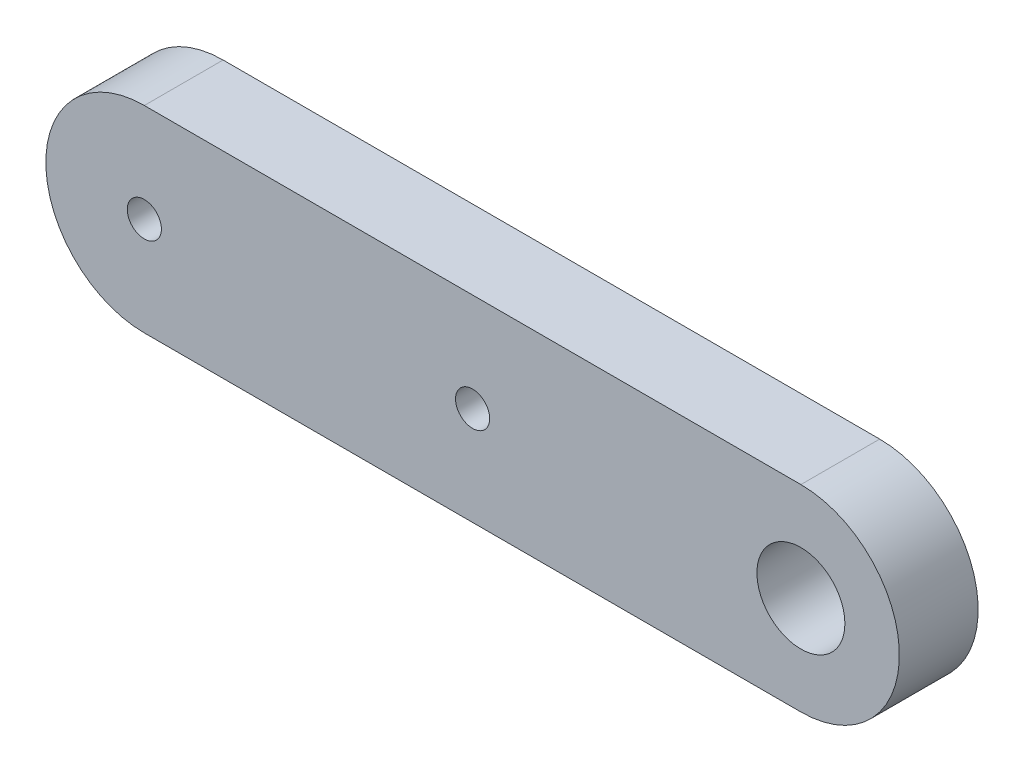
from build123d import *

# Parameters (mm, degrees)
BOSS_EXTRUDE1_DEPTH = 6
SKETCH2_R           = 1.3
CUT_EXTRUDE1_DEPTH  = 59.296655136
LPATTERN1_COUNT     = 4
LPATTERN1_PITCH     = 25
SKETCH3_R           = 3.35
CUT_EXTRUDE2_DEPTH  = 59.296655136


with BuildPart() as part:
    # Sketch1 → Boss-Extrude1 (new body)
    with BuildSketch(Plane.XY):
        with BuildLine():
            Line((50, 7.5), (0, 7.5))
            ThreePointArc((0, 7.5), (-7.5, 0), (0, -7.5))
            Line((0, -7.5), (50, -7.5))
            ThreePointArc((50, -7.5), (57.5, 0), (50, 7.5))
        make_face()
    extrude(amount=BOSS_EXTRUDE1_DEPTH)

    # Sketch2 → Cut-Extrude1 (cut, through all)
    with BuildSketch(Plane.XY.offset(6)):
        Circle(SKETCH2_R)
        with Locations((50, 0)):
            Circle(SKETCH2_R)
    cut_extrude1 = extrude(amount=-CUT_EXTRUDE1_DEPTH, mode=Mode.SUBTRACT)

    # LPattern1: Cut-Extrude1 ×4
    with Locations(*[(i * LPATTERN1_PITCH, 0, 0) for i in range(1, LPATTERN1_COUNT)]):
        add(cut_extrude1, mode=Mode.SUBTRACT)

    # Sketch3 → Cut-Extrude2 (cut, through all)
    with BuildSketch(Plane.XY.offset(6)):
        with Locations((50, 0)):
            Circle(SKETCH3_R)
    extrude(amount=-CUT_EXTRUDE2_DEPTH, mode=Mode.SUBTRACT)


solid = part.part
